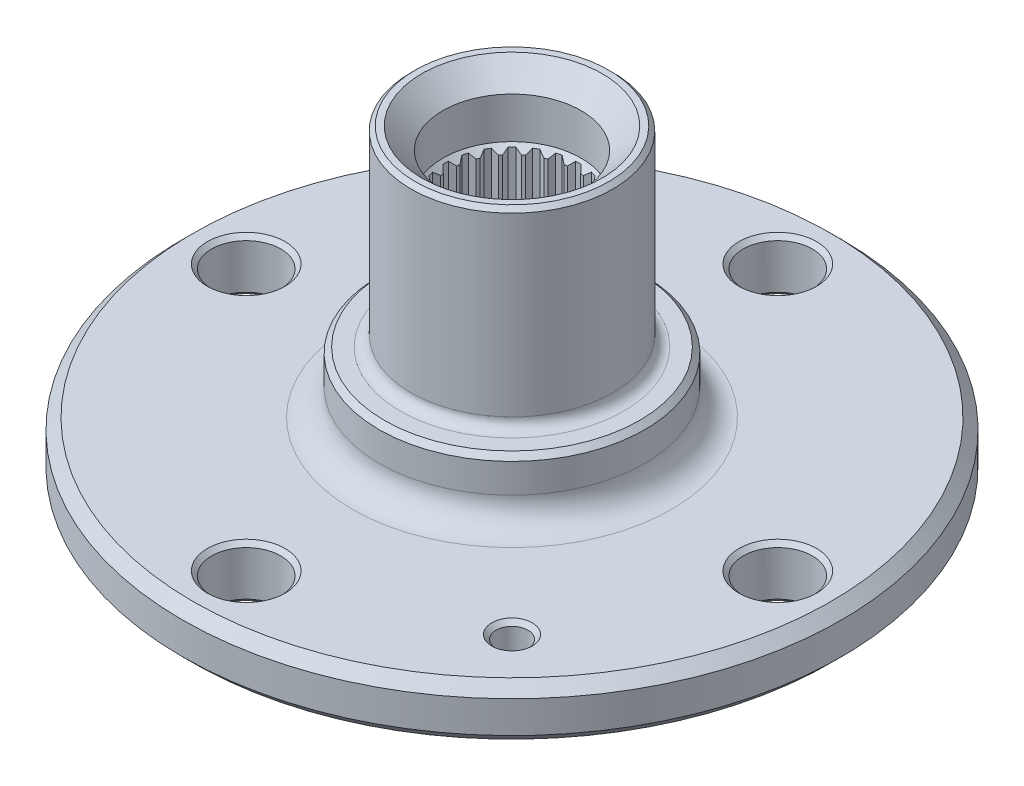
from build123d import *

# Parameters (mm, degrees)
ESBO_O2_R             = 6.5
ESBO_O2_R_2           = 3
CORTE_EXTRUS_O1_DEPTH = 105.853469184
CHANFRO2_SIZE         = 2
CHANFRO3_SIZE         = 1.5
CHANFRO3_SIZE2        = 0.866025404
CORTE_EXTRUS_O2_DEPTH = 107.244999882
CHANFRO1_SIZE         = 4
CHANFRO4_SIZE         = 0.8
CHANFRO5_SIZE         = 2
FILETE1_R             = 2
FILETE2_R             = 5
CHANFRO6_SIZE         = 1
CHANFRO7_SIZE         = 0.8
CHANFRO8_SIZE         = 2
FILETE3_R             = 1.5
FILETE4_R             = 2
CHANFRO9_SIZE         = 1
CHANFRO10_SIZE        = 0.5
FILETE5_R             = 1


with BuildPart() as part:
    # Esboço1 → Revolução1 (revolve)
    with BuildSketch(Plane.XY, mode=Mode.PRIVATE) as revolu_o1_sk:
        Polygon((13, 35.02696567), (11.75, 35.02696567), (11.75, -12.97303433), (24, -12.97303433), (24, -24.97303433), (27, -24.97303433), (27, -17.47303433), (31, -17.47303433), (31, -11.47303433), (62, -11.47303433), (62, -1.47303433), (25, -1.47303433), (25, 10.02696567), (19, 10.02696567), (19, 46.02696567), (13, 46.02696567), align=None)
    revolve(revolu_o1_sk.sketch.rotate(Axis((0, -46.742469546, 0), (0, 1, 0)), 90), axis=Axis((0, -46.742469546, 0), (0, 1, 0)))

    # Esboço2 → Corte-extrusão1 (cut, through all)
    with BuildSketch(Plane.XZ.offset(11.47303433)):
        with Locations(Location((0, 50, 0), (0, 0, 270))):
            Circle(ESBO_O2_R)
        with Locations(Location((-35.355339059, -35.355339059, 0), (0, 0, 270))):
            Circle(ESBO_O2_R_2)
        with Locations(Location((50, 0, 0), (0, 0, 270))):
            Circle(ESBO_O2_R)
        with Locations(Location((35.355339059, 35.355339059, 0), (0, 0, 270))):
            Circle(ESBO_O2_R_2)
        with Locations(Location((0, -50, 0), (0, 0, 270))):
            Circle(ESBO_O2_R)
        with Locations(Location((-50, 0, 0), (0, 0, 270))):
            Circle(ESBO_O2_R)
    extrude(amount=-CORTE_EXTRUS_O1_DEPTH, mode=Mode.SUBTRACT)

    # Chanfro2
    # the kernel refuses this chamfer: 2 mm, written as the material it takes off along each edge
    with BuildSketch(Plane(origin=(0, 35.02696567, 0), x_dir=(0, 0, -1), z_dir=(1, 0, 0))) as chanfro2_piece_1_section:
        Polygon((11.75 + CHANFRO2_SIZE, 0), (11.75, -CHANFRO2_SIZE), (11.75, 0), align=None)
    chanfro2_piece_1 = revolve(axis=Axis((0, 35.02696567, 0), (0, 1, 0)), mode=Mode.PRIVATE)
    chanfro2_piece_1 = chanfro2_piece_1 & Plane(origin=(0, 33.660711879, 0), x_dir=(0, 0, -1), z_dir=(0, -1, 0)) * Cylinder(13, 55, mode=Mode.PRIVATE)
    add(chanfro2_piece_1, mode=Mode.SUBTRACT)

    # Chanfro3
    chanfro3_edges = [part.edges().sort_by_distance(p)[0] for p in [
        (0, -12.97303433, 11.75),
    ]]
    chanfro3_side = [part.faces().sort_by_distance(p)[0] for p in [
        (0, -12.97303433, 12.42882251),
    ]]
    chamfer(chanfro3_edges, length=CHANFRO3_SIZE, length2=CHANFRO3_SIZE2, reference=chanfro3_side[0])

    # Esboço3 → Corte-extrusão2 (cut, through all)
    with BuildSketch(Plane(origin=(0, 35.02696567, 0), x_dir=(1, 0, 0), z_dir=(0, 1, 0))):
        with BuildLine():
            Line((-0.5, 12.489995997), (-1.25, 11.683321446))
            ThreePointArc((-1.25, 11.683321446), (0, 11.75), (1.25, 11.683321446))
            Line((1.25, 11.683321446), (0.5, 12.489995997))
            ThreePointArc((0.5, 12.489995997), (0, 12.5), (-0.5, 12.489995997))
        make_face()
        with BuildLine():
            Line((2.749685924, 12.193819226), (1.816458817, 11.608745727))
            ThreePointArc((1.816458817, 11.608745727), (3.04112378, 11.349628459), (4.231273383, 10.961698115))
            Line((4.231273383, 10.961698115), (3.71561175, 11.935000181))
            ThreePointArc((3.71561175, 11.935000181), (3.235238064, 12.074072828), (2.749685924, 12.193819226))
        make_face()
        with BuildLine():
            Line((5.811985296, 11.066653826), (4.759128968, 10.743053172))
            ThreePointArc((4.759128968, 10.743053172), (5.875, 10.175798494), (6.924192478, 9.493053172))
            Line((6.924192478, 9.493053172), (6.6780107, 10.566653826))
            ThreePointArc((6.6780107, 10.566653826), (6.25, 10.825317547), (5.811985296, 11.066653826))
        make_face()
        with BuildLine():
            Line((8.478207476, 9.185314257), (7.377472345, 9.145239297))
            ThreePointArc((7.377472345, 9.145239297), (8.308504679, 8.308504679), (9.145239298, 7.377472344))
            Line((9.145239298, 7.377472344), (9.185314257, 8.478207475))
            ThreePointArc((9.185314257, 8.478207475), (8.838834765, 8.838834765), (8.478207476, 9.185314257))
        make_face()
        with BuildLine():
            Line((10.566653826, 6.6780107), (9.493053173, 6.924192477))
            ThreePointArc((9.493053173, 6.924192477), (10.175798495, 5.875), (10.743053173, 4.759128968))
            Line((10.743053173, 4.759128968), (11.066653826, 5.811985296))
            ThreePointArc((11.066653826, 5.811985296), (10.825317547, 6.25), (10.566653826, 6.6780107))
        make_face()
        with BuildLine():
            Line((11.935000181, 3.71561175), (10.961698115, 4.231273383))
            ThreePointArc((10.961698115, 4.231273383), (11.349628459, 3.04112378), (11.608745728, 1.816458817))
            Line((11.608745728, 1.816458817), (12.193819226, 2.749685924))
            ThreePointArc((12.193819226, 2.749685924), (12.074072829, 3.235238064), (11.935000181, 3.71561175))
        make_face()
        with BuildLine():
            Line((12.489995997, 0.5), (11.683321446, 1.25))
            ThreePointArc((11.683321446, 1.25), (11.75, 0), (11.683321446, -1.25))
            Line((11.683321446, -1.25), (12.489995997, -0.5))
            ThreePointArc((12.489995997, -0.5), (12.5, 0), (12.489995997, 0.5))
        make_face()
        with BuildLine():
            Line((12.193819226, -2.749685924), (11.608745728, -1.816458818))
            ThreePointArc((11.608745728, -1.816458818), (11.349628459, -3.04112378), (10.961698115, -4.231273383))
            Line((10.961698115, -4.231273383), (11.935000181, -3.715611751))
            ThreePointArc((11.935000181, -3.715611751), (12.074072829, -3.235238064), (12.193819226, -2.749685924))
        make_face()
        with BuildLine():
            Line((11.066653826, -5.811985297), (10.743053173, -4.759128968))
            ThreePointArc((10.743053173, -4.759128968), (10.175798495, -5.875), (9.493053173, -6.924192478))
            Line((9.493053173, -6.924192478), (10.566653826, -6.678010701))
            ThreePointArc((10.566653826, -6.678010701), (10.825317547, -6.25), (11.066653826, -5.811985297))
        make_face()
        with BuildLine():
            Line((9.185314257, -8.478207476), (9.145239298, -7.377472345))
            ThreePointArc((9.145239298, -7.377472345), (8.308504679, -8.308504679), (7.377472345, -9.145239298))
            Line((7.377472345, -9.145239298), (8.478207476, -9.185314257))
            ThreePointArc((8.478207476, -9.185314257), (8.838834765, -8.838834765), (9.185314257, -8.478207476))
        make_face()
        with BuildLine():
            Line((6.6780107, -10.566653827), (6.924192478, -9.493053173))
            ThreePointArc((6.924192478, -9.493053173), (5.875, -10.175798495), (4.759128968, -10.743053173))
            Line((4.759128968, -10.743053173), (5.811985296, -11.066653827))
            ThreePointArc((5.811985296, -11.066653827), (6.25, -10.825317548), (6.6780107, -10.566653827))
        make_face()
        with BuildLine():
            Line((3.715611751, -11.935000181), (4.231273383, -10.961698115))
            ThreePointArc((4.231273383, -10.961698115), (3.04112378, -11.349628459), (1.816458817, -11.608745728))
            Line((1.816458817, -11.608745728), (2.749685924, -12.193819226))
            ThreePointArc((2.749685924, -12.193819226), (3.235238064, -12.074072829), (3.715611751, -11.935000181))
        make_face()
        with BuildLine():
            Line((0.5, -12.489995997), (1.25, -11.683321446))
            ThreePointArc((1.25, -11.683321446), (0, -11.75), (-1.25, -11.683321446))
            Line((-1.25, -11.683321446), (-0.5, -12.489995997))
            ThreePointArc((-0.5, -12.489995997), (0, -12.5), (0.5, -12.489995997))
        make_face()
        with BuildLine():
            Line((-2.749685924, -12.193819226), (-1.816458817, -11.608745728))
            ThreePointArc((-1.816458817, -11.608745728), (-3.04112378, -11.349628459), (-4.231273383, -10.961698115))
            Line((-4.231273383, -10.961698115), (-3.71561175, -11.935000181))
            ThreePointArc((-3.71561175, -11.935000181), (-3.235238064, -12.074072829), (-2.749685924, -12.193819226))
        make_face()
        with BuildLine():
            Line((-5.811985296, -11.066653827), (-4.759128968, -10.743053173))
            ThreePointArc((-4.759128968, -10.743053173), (-5.875, -10.175798495), (-6.924192478, -9.493053173))
            Line((-6.924192478, -9.493053173), (-6.6780107, -10.566653827))
            ThreePointArc((-6.6780107, -10.566653827), (-6.25, -10.825317548), (-5.811985296, -11.066653827))
        make_face()
        with BuildLine():
            Line((-8.478207476, -9.185314257), (-7.377472345, -9.145239298))
            ThreePointArc((-7.377472345, -9.145239298), (-8.308504679, -8.308504679), (-9.145239298, -7.377472345))
            Line((-9.145239298, -7.377472345), (-9.185314257, -8.478207476))
            ThreePointArc((-9.185314257, -8.478207476), (-8.838834765, -8.838834765), (-8.478207476, -9.185314257))
        make_face()
        with BuildLine():
            Line((-10.566653826, -6.678010701), (-9.493053173, -6.924192478))
            ThreePointArc((-9.493053173, -6.924192478), (-10.175798495, -5.875), (-10.743053173, -4.759128968))
            Line((-10.743053173, -4.759128968), (-11.066653826, -5.811985297))
            ThreePointArc((-11.066653826, -5.811985297), (-10.825317547, -6.25), (-10.566653826, -6.678010701))
        make_face()
        with BuildLine():
            Line((-11.935000181, -3.715611751), (-10.961698115, -4.231273383))
            ThreePointArc((-10.961698115, -4.231273383), (-11.349628459, -3.04112378), (-11.608745728, -1.816458818))
            Line((-11.608745728, -1.816458818), (-12.193819226, -2.749685924))
            ThreePointArc((-12.193819226, -2.749685924), (-12.074072829, -3.235238064), (-11.935000181, -3.715611751))
        make_face()
        with BuildLine():
            Line((-12.489995997, -0.5), (-11.683321446, -1.25))
            ThreePointArc((-11.683321446, -1.25), (-11.75, 0), (-11.683321446, 1.25))
            Line((-11.683321446, 1.25), (-12.489995997, 0.5))
            ThreePointArc((-12.489995997, 0.5), (-12.5, 0), (-12.489995997, -0.5))
        make_face()
        with BuildLine():
            Line((-12.193819226, 2.749685924), (-11.608745728, 1.816458817))
            ThreePointArc((-11.608745728, 1.816458817), (-11.349628459, 3.04112378), (-10.961698115, 4.231273383))
            Line((-10.961698115, 4.231273383), (-11.935000181, 3.71561175))
            ThreePointArc((-11.935000181, 3.71561175), (-12.074072829, 3.235238063), (-12.193819226, 2.749685924))
        make_face()
        with BuildLine():
            Line((-11.066653826, 5.811985296), (-10.743053173, 4.759128968))
            ThreePointArc((-10.743053173, 4.759128968), (-10.175798495, 5.875), (-9.493053173, 6.924192477))
            Line((-9.493053173, 6.924192477), (-10.566653826, 6.6780107))
            ThreePointArc((-10.566653826, 6.6780107), (-10.825317547, 6.25), (-11.066653826, 5.811985296))
        make_face()
        with BuildLine():
            Line((-9.185314257, 8.478207475), (-9.145239298, 7.377472344))
            ThreePointArc((-9.145239298, 7.377472344), (-8.308504679, 8.308504679), (-7.377472345, 9.145239297))
            Line((-7.377472345, 9.145239297), (-8.478207476, 9.185314257))
            ThreePointArc((-8.478207476, 9.185314257), (-8.838834765, 8.838834765), (-9.185314257, 8.478207475))
        make_face()
        with BuildLine():
            Line((-6.6780107, 10.566653826), (-6.924192478, 9.493053172))
            ThreePointArc((-6.924192478, 9.493053172), (-5.875, 10.175798494), (-4.759128968, 10.743053172))
            Line((-4.759128968, 10.743053172), (-5.811985296, 11.066653826))
            ThreePointArc((-5.811985296, 11.066653826), (-6.25, 10.825317547), (-6.6780107, 10.566653826))
        make_face()
        with BuildLine():
            Line((-3.715611751, 11.935000181), (-4.231273383, 10.961698115))
            ThreePointArc((-4.231273383, 10.961698115), (-3.04112378, 11.349628459), (-1.816458817, 11.608745727))
            Line((-1.816458817, 11.608745727), (-2.749685924, 12.193819226))
            ThreePointArc((-2.749685924, 12.193819226), (-3.235238064, 12.074072828), (-3.715611751, 11.935000181))
        make_face()
    extrude(amount=-CORTE_EXTRUS_O2_DEPTH, mode=Mode.SUBTRACT)

    # Chanfro1
    chanfro1_edges = [part.edges().sort_by_distance(p)[0] for p in [
        (0, 46.02696567, 13),
    ]]
    chamfer(chanfro1_edges, length=CHANFRO1_SIZE)

    # Chanfro4
    chanfro4_edges = [part.edges().sort_by_distance(p)[0] for p in [
        (0, 46.02696567, 19),
    ]]
    chamfer(chanfro4_edges, length=CHANFRO4_SIZE)

    # Chanfro5
    chanfro5_edges = [part.edges().sort_by_distance(p)[0] for p in [
        (0, -1.47303433, 62),
    ]]
    chamfer(chanfro5_edges, length=CHANFRO5_SIZE)

    # Filete1
    filete1_edges = [part.edges().sort_by_distance(p)[0] for p in [
        (0, 10.02696567, 19),
    ]]
    fillet(filete1_edges, radius=FILETE1_R)

    # Filete2
    filete2_edges = [part.edges().sort_by_distance(p)[0] for p in [
        (0, -1.47303433, 25),
    ]]
    fillet(filete2_edges, radius=FILETE2_R)

    # Chanfro6
    chanfro6_edges = [part.edges().sort_by_distance(p)[0] for p in [
        (0, 10.02696567, 25),
    ]]
    chamfer(chanfro6_edges, length=CHANFRO6_SIZE)

    # Chanfro7
    chanfro7_edges = [part.edges().sort_by_distance(p)[0] for p in [
        (0, -1.47303433, 56.5),
        (0, -11.47303433, 56.5),
        (35.355339059, -1.47303433, 38.355339059),
        (35.355339059, -11.47303433, 38.355339059),
        (-35.355339059, -1.47303433, -32.355339059),
        (-35.355339059, -11.47303433, -32.355339059),
        (50, -1.47303433, 6.5),
        (50, -11.47303433, 6.5),
        (0, -1.47303433, -43.5),
        (0, -11.47303433, -43.5),
        (-50, -1.47303433, 6.5),
        (-50, -11.47303433, 6.5),
    ]]
    chamfer(chanfro7_edges, length=CHANFRO7_SIZE)

    # Chanfro8
    chanfro8_edges = [part.edges().sort_by_distance(p)[0] for p in [
        (0, -11.47303433, 62),
    ]]
    chamfer(chanfro8_edges, length=CHANFRO8_SIZE)

    # Filete3
    filete3_edges = [part.edges().sort_by_distance(p)[0] for p in [
        (0, -11.47303433, 31),
    ]]
    fillet(filete3_edges, radius=FILETE3_R)

    # Filete4
    filete4_edges = [part.edges().sort_by_distance(p)[0] for p in [
        (0, -17.47303433, 27),
    ]]
    fillet(filete4_edges, radius=FILETE4_R)

    # Chanfro9
    chanfro9_edges = [part.edges().sort_by_distance(p)[0] for p in [
        (0, -24.97303433, 24),
    ]]
    chamfer(chanfro9_edges, length=CHANFRO9_SIZE)

    # Chanfro10
    chanfro10_edges = [part.edges().sort_by_distance(p)[0] for p in [
        (0, -24.97303433, 27),
    ]]
    chamfer(chanfro10_edges, length=CHANFRO10_SIZE)

    # Filete5
    filete5_edges = [part.edges().sort_by_distance(p)[0] for p in [
        (0, -12.97303433, 24),
    ]]
    fillet(filete5_edges, radius=FILETE5_R)


solid = part.part
